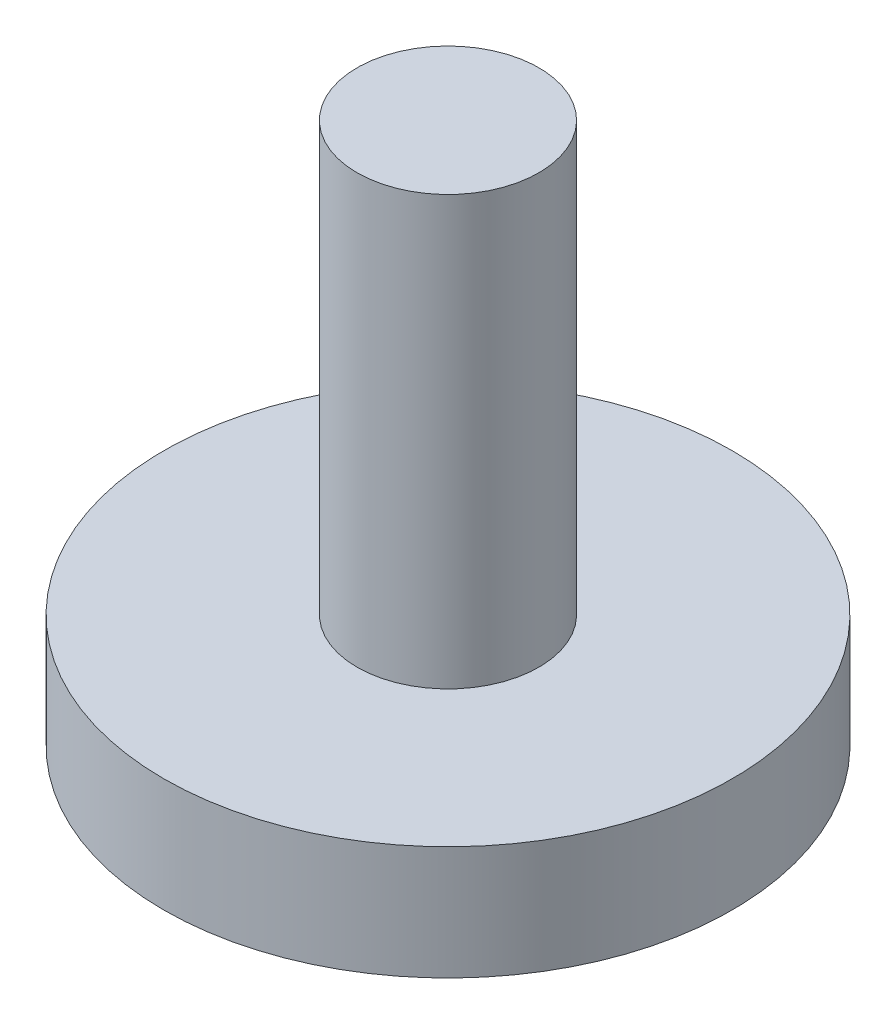
from build123d import *

# Parameters (mm, degrees)
SKETCH1_R           = 7.5
BOSS_EXTRUDE1_DEPTH = 3
SKETCH2_R           = 2.4
BOSS_EXTRUDE2_DEPTH = 11.3


with BuildPart() as part:
    # Sketch1 → Boss-Extrude1 (new body)
    with BuildSketch(Plane(origin=(0, 0, 0), x_dir=(1, 0, 0), z_dir=(0, 1, 0))):
        Circle(SKETCH1_R)
    extrude(amount=BOSS_EXTRUDE1_DEPTH)

    # Sketch2 → Boss-Extrude2 (add)
    with BuildSketch(Plane(origin=(0, 3, 0), x_dir=(1, 0, 0), z_dir=(0, 1, 0))):
        Circle(SKETCH2_R)
    extrude(amount=BOSS_EXTRUDE2_DEPTH)


solid = part.part
